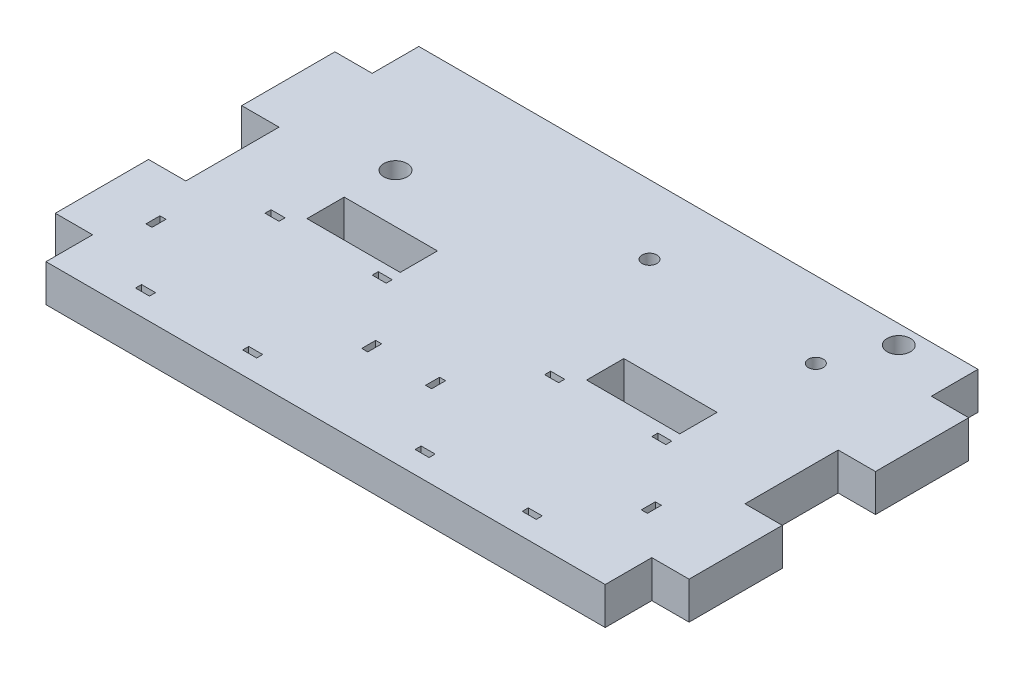
from build123d import *

# Parameters (mm, degrees)
SKETCH1_W           = 120
SKETCH1_H           = 80
SKETCH1_R           = 1.6
SKETCH1_R_2         = 2.5
SKETCH1_W_2         = 3
SKETCH1_H_2         = 1.3
SKETCH1_W_3         = 1.3
SKETCH1_H_3         = 3
BOSS_EXTRUDE1_DEPTH = 8
CUT_EXTRUDE1_DEPTH  = 4
SKETCH3_W           = 20
SKETCH3_H           = 8
BOSS_EXTRUDE2_DEPTH = 8
CUT_EXTRUDE3_REACH  = 81.297
SKETCH5_W           = 20
SKETCH5_H           = 8


with BuildPart() as part:
    # Sketch1 → Boss-Extrude1 (new body)
    with BuildSketch(Plane(origin=(0, 0, 0), x_dir=(1, 0, 0), z_dir=(0, 1, 0))):
        Rectangle(SKETCH1_W, SKETCH1_H)
        with Locations((41.5, 23.7)):
            Circle(SKETCH1_R, mode=Mode.SUBTRACT)
        with Locations((4.3, 25.2)):
            Circle(SKETCH1_R, mode=Mode.SUBTRACT)
        with Locations((-39.5, 14.5)):
            Circle(SKETCH1_R_2, mode=Mode.SUBTRACT)
        with Locations((47, 36)):
            Circle(SKETCH1_R_2, mode=Mode.SUBTRACT)
        with Locations((39, -6.85)):
            Rectangle(SKETCH1_W_2, SKETCH1_H_2, mode=Mode.SUBTRACT)
        with Locations((16, -6.85)):
            Rectangle(SKETCH1_W_2, SKETCH1_H_2, mode=Mode.SUBTRACT)
        with Locations((4.35, -20.75)):
            Rectangle(SKETCH1_W_3, SKETCH1_H_3, mode=Mode.SUBTRACT)
        with Locations((50.65, -20.75)):
            Rectangle(SKETCH1_W_3, SKETCH1_H_3, mode=Mode.SUBTRACT)
        with Locations((39, -34.65)):
            Rectangle(SKETCH1_W_2, SKETCH1_H_2, mode=Mode.SUBTRACT)
        with Locations((16, -34.65)):
            Rectangle(SKETCH1_W_2, SKETCH1_H_2, mode=Mode.SUBTRACT)
        with Locations((-21, -34.65)):
            Rectangle(SKETCH1_W_2, SKETCH1_H_2, mode=Mode.SUBTRACT)
        with Locations((-44, -34.65)):
            Rectangle(SKETCH1_W_2, SKETCH1_H_2, mode=Mode.SUBTRACT)
        with Locations((-55.65, -20.75)):
            Rectangle(SKETCH1_W_3, SKETCH1_H_3, mode=Mode.SUBTRACT)
        with Locations((-44, -6.85)):
            Rectangle(SKETCH1_W_2, SKETCH1_H_2, mode=Mode.SUBTRACT)
        with Locations((-9.35, -20.75)):
            Rectangle(SKETCH1_W_3, SKETCH1_H_3, mode=Mode.SUBTRACT)
        with Locations((-21, -6.85)):
            Rectangle(SKETCH1_W_2, SKETCH1_H_2, mode=Mode.SUBTRACT)
    extrude(amount=BOSS_EXTRUDE1_DEPTH)

    # Sketch2 → Cut-Extrude1 (cut)
    with BuildSketch(Plane(origin=(0, 0, 0), x_dir=(-1, 0, 0), z_dir=(0, -1, 0))):
        Polygon((-7.475426481, 25.2), (-5.88771324, 22.45), (-2.71228676, 22.45), (-1.124573519, 25.2), (-2.71228676, 27.95), (-5.88771324, 27.95), align=None)
        Polygon((-44.675426481, 23.7), (-43.08771324, 20.95), (-39.91228676, 20.95), (-38.324573519, 23.7), (-39.91228676, 26.45), (-43.08771324, 26.45), align=None)
    extrude(amount=-CUT_EXTRUDE1_DEPTH, mode=Mode.SUBTRACT)

    # Sketch3 → Boss-Extrude2 (add)
    with BuildSketch(Plane.ZY.offset(60)):
        with Locations((-20, 4)):
            Rectangle(SKETCH3_W, SKETCH3_H)
        with Locations((20, 4)):
            Rectangle(SKETCH3_W, SKETCH3_H)
    boss_extrude2 = extrude(amount=BOSS_EXTRUDE2_DEPTH)

    # Mirror1: Boss-Extrude2 across plane
    add(boss_extrude2.mirror(Plane.ZY))

    # Sketch5 → Cut-Extrude3 (cut, up to next)
    with BuildSketch(Plane(origin=(0, 0, 0), x_dir=(-1, 0, 0), z_dir=(0, -1, 0)), mode=Mode.PRIVATE) as cut_extrude3_sk1:
        with Locations((30, 0)):
            Rectangle(SKETCH5_W, SKETCH5_H)
    cut_extrude3_tool1 = extrude(cut_extrude3_sk1.sketch, amount=-CUT_EXTRUDE3_REACH, mode=Mode.PRIVATE) & part.part
    cut_extrude3 = cut_extrude3_tool1.solids().sort_by_distance((-30, 0, 0))[0]
    add(cut_extrude3, mode=Mode.SUBTRACT)

    # Mirror2: Cut-Extrude3 across plane
    add(cut_extrude3.mirror(Plane.ZY), mode=Mode.SUBTRACT)


solid = part.part
